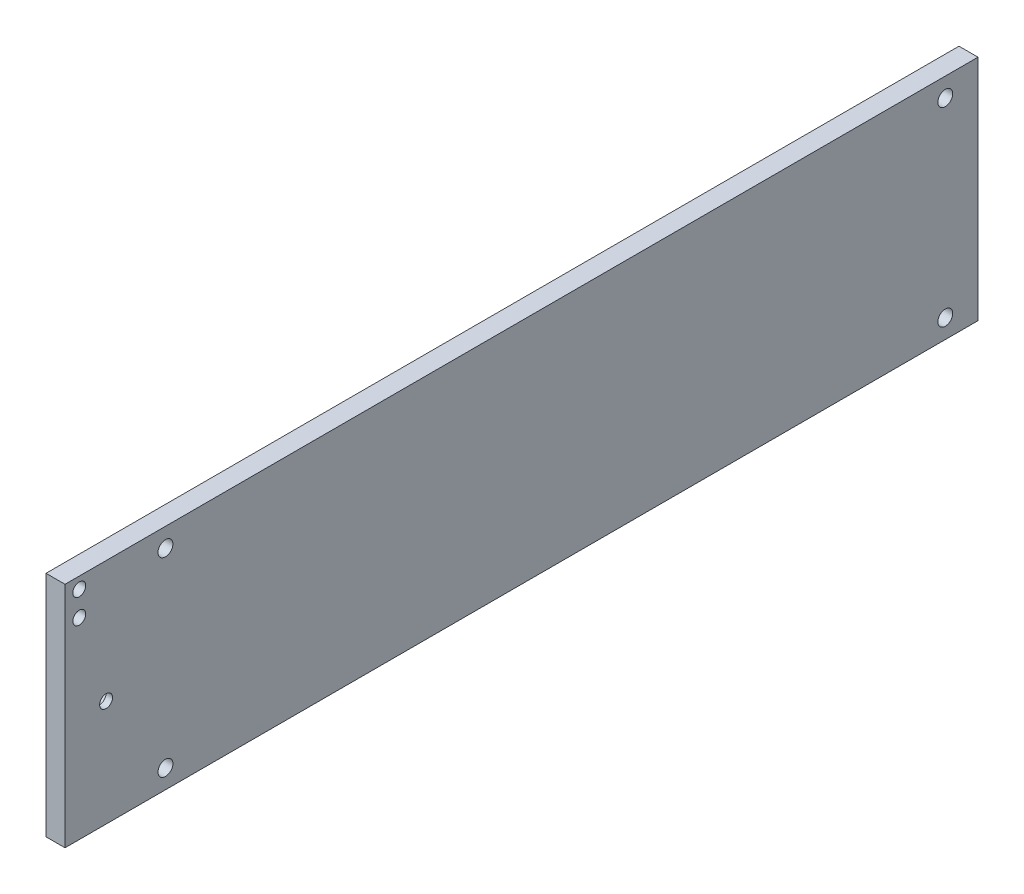
from build123d import *

# Parameters (mm, degrees)
SKETCH1_W                                      = 304.8
SKETCH1_H                                      = 76.2
BOSS_EXTRUDE1_DEPTH                            = 6.35
F_10_CLEARANCE_HOLE1_D                         = 4.9784
CBORE_FOR_8_SOCKET_HEAD_CAP_SCREW2_D           = 4.3053
CBORE_FOR_8_SOCKET_HEAD_CAP_SCREW2_DEPTH       = 10.668
CBORE_FOR_8_SOCKET_HEAD_CAP_SCREW2_CBORE_D     = 7.9375
CBORE_FOR_8_SOCKET_HEAD_CAP_SCREW2_CBORE_DEPTH = 4.1656
CBORE_FOR_8_SOCKET_HEAD_CAP_SCREW2_TIP         = 1.293442612
F_8_CLEARANCE_HOLE1_D                          = 4.3053


with BuildPart() as part:
    # Sketch1 → Boss-Extrude1 (new body)
    with BuildSketch(Plane(origin=(0, 0, 0), x_dir=(0, 0, -1), z_dir=(1, 0, 0))):
        Rectangle(SKETCH1_W, SKETCH1_H)
    extrude(amount=BOSS_EXTRUDE1_DEPTH)

    # #10 Clearance Hole1 (through all)
    with Locations(Plane(origin=(6.35, 0, 0), x_dir=(0, 0, -1), z_dir=(1, 0, 0))):
        with Locations((-118.872, 31.75), (-118.872, -31.75), (141.478, -31.75), (141.478, 31.75)):
            Hole(F_10_CLEARANCE_HOLE1_D / 2)

    # CBORE for #8 Socket Head Cap Screw2
    with Locations(Plane.ZY):
        with Locations((138.684, -2.54)):
            CounterBoreHole(CBORE_FOR_8_SOCKET_HEAD_CAP_SCREW2_D / 2, CBORE_FOR_8_SOCKET_HEAD_CAP_SCREW2_CBORE_D / 2, CBORE_FOR_8_SOCKET_HEAD_CAP_SCREW2_CBORE_DEPTH, depth=CBORE_FOR_8_SOCKET_HEAD_CAP_SCREW2_DEPTH)
            with Locations((0, 0, -(CBORE_FOR_8_SOCKET_HEAD_CAP_SCREW2_DEPTH + CBORE_FOR_8_SOCKET_HEAD_CAP_SCREW2_TIP / 2))):  # 118° drill point
                Cone(0, CBORE_FOR_8_SOCKET_HEAD_CAP_SCREW2_D / 2, CBORE_FOR_8_SOCKET_HEAD_CAP_SCREW2_TIP, mode=Mode.SUBTRACT)

    # #8 Clearance Hole1 (through all)
    with Locations(Plane.ZY):
        with Locations((147.6375, 34.2519), (147.6375, 26.0731)):
            Hole(F_8_CLEARANCE_HOLE1_D / 2)


solid = part.part
